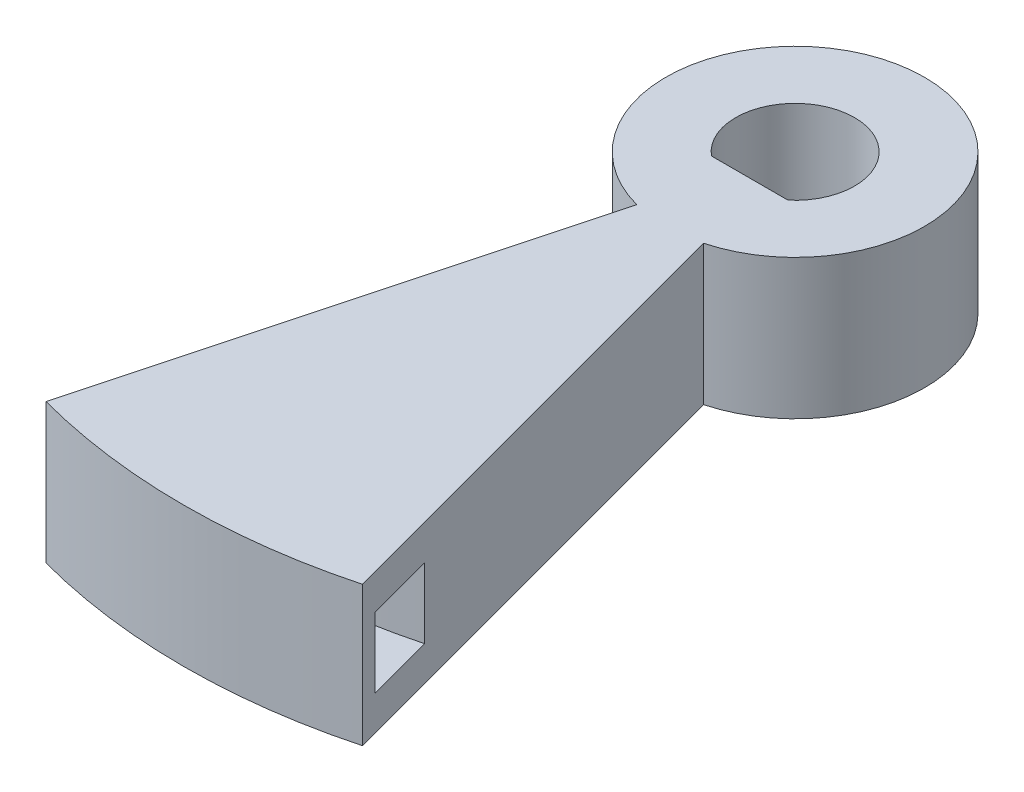
from build123d import *

# Parameters (mm, degrees)
SKETCH1_R           = 17.5
BOSS_EXTRUDE1_DEPTH = 4
SKETCH2_R           = 3.7
BOSS_EXTRUDE2_DEPTH = 8.5
SKETCH21_R          = 17
SKETCH21_R_2        = 15
CUT_EXTRUDE1_DEPTH  = 1
CUT_EXTRUDE2_DEPTH  = 6
BOSS_EXTRUDE3_START = 6
BOSS_EXTRUDE3_DEPTH = 6
CUT_EXTRUDE3_START  = -8.5
SKETCH27_R          = 3.7
CUT_EXTRUDE3_DEPTH  = 8.5


with BuildPart() as part:
    # Sketch1 → Boss-Extrude1 (new body)
    with BuildSketch(Plane(origin=(0, 0, 0), x_dir=(1, 0, 0), z_dir=(0, 1, 0))):
        Circle(SKETCH1_R)
        with BuildLine():
            ThreePointArc((-1.095445115, -1.3), (0, 1.7), (1.095445115, -1.3))
            Line((1.095445115, -1.3), (-1.095445115, -1.3))
        make_face(mode=Mode.SUBTRACT)
    extrude(amount=BOSS_EXTRUDE1_DEPTH)

    # Sketch2 → Boss-Extrude2 (add)
    with BuildSketch(Plane(origin=(0, 4, 0), x_dir=(1, 0, 0), z_dir=(0, 1, 0))):
        Circle(SKETCH2_R)
        with BuildLine():
            Line((-1.095445115, -1.3), (1.095445115, -1.3))
            ThreePointArc((1.095445115, -1.3), (0, 1.7), (-1.095445115, -1.3))
        make_face(mode=Mode.SUBTRACT)
    extrude(amount=BOSS_EXTRUDE2_DEPTH)

    # Sketch21 → Cut-Extrude1 (cut, symmetric)
    with BuildSketch(Plane(origin=(0, 2, 0), x_dir=(1, 0, 0), z_dir=(0, 1, 0))):
        Circle(SKETCH21_R)
        Circle(SKETCH21_R_2, mode=Mode.SUBTRACT)
    extrude(amount=CUT_EXTRUDE1_DEPTH, both=True, mode=Mode.SUBTRACT)

    # Sketch24 → Cut-Extrude2 (cut)
    with BuildSketch(Plane.XZ):
        with BuildLine():
            Line((-1.095445115, 1.3), (-0.34833395, 1.3))
            Line((-0.34833395, 1.3), (-4.529333289, 16.90370196))
            ThreePointArc((-4.529333289, 16.90370196), (-10.653325008, -13.883683455), (17.5, 0))
            ThreePointArc((17.5, 0), (13.883683455, 10.653325008), (4.529333289, 16.90370196))
            Line((4.529333289, 16.90370196), (0.34833395, 1.3))
            Line((0.34833395, 1.3), (1.095445115, 1.3))
            ThreePointArc((1.095445115, 1.3), (0, -1.7), (-1.095445115, 1.3))
        make_face()
    extrude(amount=-CUT_EXTRUDE2_DEPTH, mode=Mode.SUBTRACT)

    # Sketch26 → Boss-Extrude3 (add)
    with BuildSketch(Plane.XZ.offset(-6).offset(BOSS_EXTRUDE3_START)):
        with BuildLine():
            Line((-0.957630467, 3.573925557), (-0.34833395, 1.3))
            Line((-0.34833395, 1.3), (-1.095445115, 1.3))
            ThreePointArc((-1.095445115, 1.3), (0, -1.7), (1.095445115, 1.3))
            Line((1.095445115, 1.3), (0.34833395, 1.3))
            Line((0.34833395, 1.3), (0.957630467, 3.573925557))
            ThreePointArc((0.957630467, 3.573925557), (0, -3.7), (-0.957630467, 3.573925557))
        make_face()
    extrude(amount=-BOSS_EXTRUDE3_DEPTH)

    # Sketch27 → Cut-Extrude3 (cut)
    with BuildSketch(Plane(origin=(0, 12.5, 0), x_dir=(1, 0, 0), z_dir=(0, 1, 0)).offset(CUT_EXTRUDE3_START)):
        Circle(SKETCH27_R)
        with BuildLine():
            Line((-1.095445115, -1.3), (1.095445115, -1.3))
            ThreePointArc((1.095445115, -1.3), (0, 1.7), (-1.095445115, -1.3))
        make_face(mode=Mode.SUBTRACT)
    extrude(amount=CUT_EXTRUDE3_DEPTH, mode=Mode.SUBTRACT)


solid = part.part
